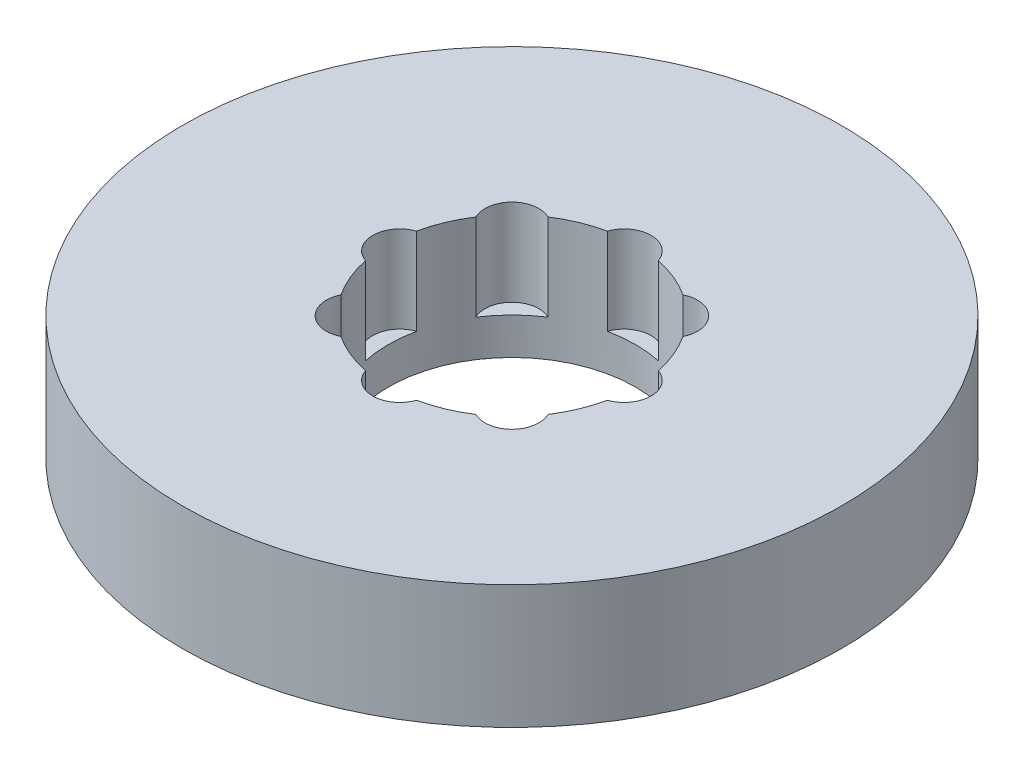
from build123d import *

# Parameters (mm, degrees)
SKETCH1_R           = 40
BOSS_EXTRUDE1_DEPTH = 15
SKETCH2_R           = 15
CUT_EXTRUDE1_DEPTH  = 59.523499554
SKETCH3_R           = 3.272290285
CUT_EXTRUDE2_DEPTH  = 10.530761863
CIRPATTERN1_COUNT   = 8


with BuildPart() as part:
    # Sketch1 → Boss-Extrude1 (new body)
    with BuildSketch(Plane(origin=(0, 0, 0), x_dir=(1, 0, 0), z_dir=(0, 1, 0))):
        Circle(SKETCH1_R)
    extrude(amount=BOSS_EXTRUDE1_DEPTH)

    # Sketch2 → Cut-Extrude1 (cut, through all)
    with BuildSketch(Plane(origin=(0, 0, 0), x_dir=(1, 0, 0), z_dir=(0, 1, 0))):
        Circle(SKETCH2_R)
    extrude(amount=CUT_EXTRUDE1_DEPTH, mode=Mode.SUBTRACT)

    # Sketch3 → Cut-Extrude2 (cut)
    with BuildSketch(Plane(origin=(0, 15, 0), x_dir=(1, 0, 0), z_dir=(0, 1, 0))):
        with Locations((-13.61814772, 0)):
            Circle(SKETCH3_R)
    cut_extrude2 = extrude(amount=-CUT_EXTRUDE2_DEPTH, mode=Mode.SUBTRACT)

    # CirPattern1: Cut-Extrude2 ×8 about axis
    cirpattern1_axis = Axis((0, 0, 0), (0, 1, 0))
    for i in range(1, CIRPATTERN1_COUNT):
        add(cut_extrude2.rotate(cirpattern1_axis, i * 360 / CIRPATTERN1_COUNT), mode=Mode.SUBTRACT)


solid = part.part
